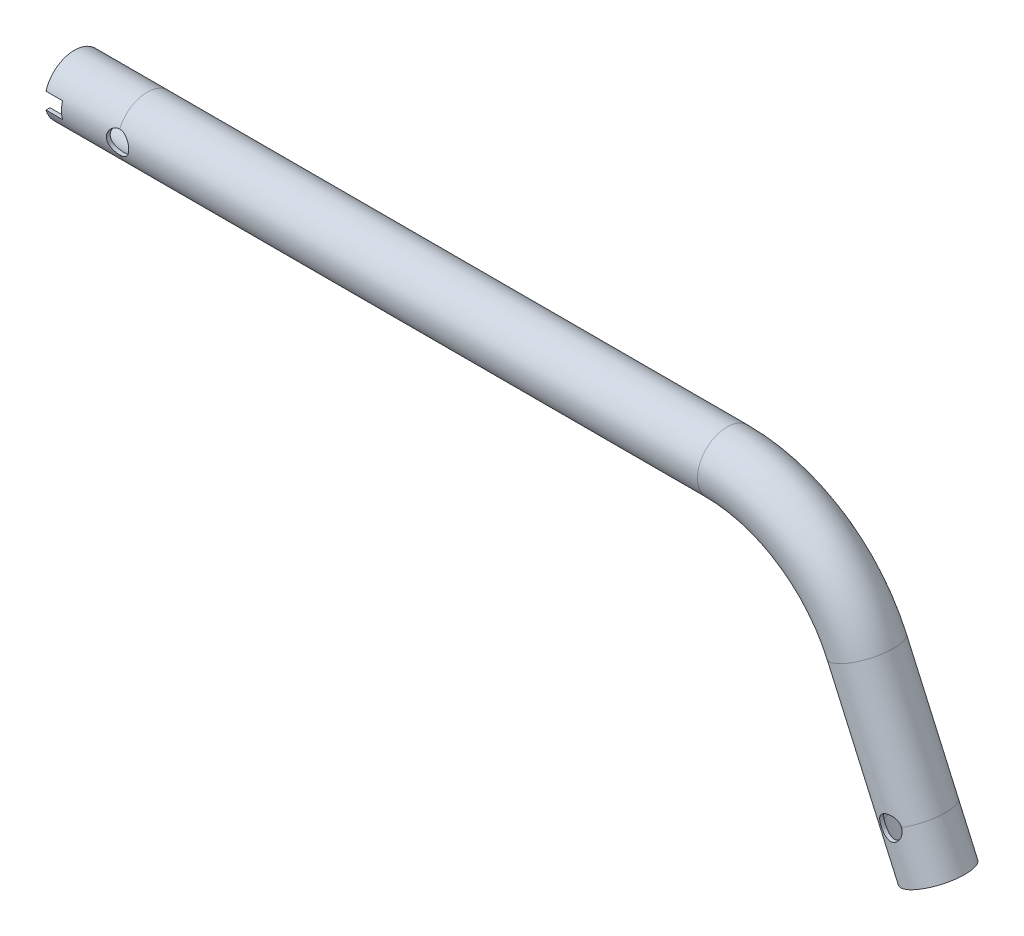
from build123d import *

# Parameters (mm, degrees)
SKETCH2_R                      = 9.25
SKETCH2_R_2                    = 8.05
CUT_EXTRUDE1_REACH             = 271.638
SKETCH3_R                      = 3.5
CUT_EXTRUDE1_DIRECTION_2_REACH = 271.638
CUT_EXTRUDE2_REACH             = 271.638
SKETCH4_R                      = 3.5
CUT_EXTRUDE3_DEPTH             = 270.638115364
CUT_EXTRUDE3_DEPTH_BACK        = 270.638115364


with BuildPart() as part:
    # Sweep1: sweep along a path in Sketch1
    with BuildLine(Plane.XY) as sweep1_path:
        Line((-22.798291955, 0), (0, 0))
        Line((0, 0), (181.888570981, 0))
        ThreePointArc((181.888570981, 0), (208.031244662, -7.743812739), (225.738752948, -28.476641132))
        Line((225.738752948, -28.476641132), (242, -65))
        Line((242, -65), (248.101049646, -78.703181865))
    # Sketch2 → Sweep1 (sweep)
    with BuildSketch(Plane.ZY.offset(22.798291955)):
        Circle(SKETCH2_R)
        Circle(SKETCH2_R_2, mode=Mode.SUBTRACT)
    sweep(path=sweep1_path.line)

    # Sketch3 → Cut-Extrude1 (cut, up to next)
    with BuildSketch(Plane.XY, mode=Mode.PRIVATE) as cut_extrude1_sk1:
        with Locations((242, -65)):
            Circle(SKETCH3_R)
    cut_extrude1_tool1 = extrude(cut_extrude1_sk1.sketch, amount=-CUT_EXTRUDE1_REACH, mode=Mode.PRIVATE) & part.part
    add(cut_extrude1_tool1.solids().sort_by_distance((242, -65, 0))[0], mode=Mode.SUBTRACT)

    # Sketch3 → Cut-Extrude1 direction 2 (cut, up to next)
    with BuildSketch(Plane.XY, mode=Mode.PRIVATE) as cut_extrude1_direction_2_sk1:
        with Locations((242, -65)):
            Circle(SKETCH3_R)
    cut_extrude1_direction_2_tool1 = extrude(cut_extrude1_direction_2_sk1.sketch, amount=CUT_EXTRUDE1_DIRECTION_2_REACH, mode=Mode.PRIVATE) & part.part
    add(cut_extrude1_direction_2_tool1.solids().sort_by_distance((242, -65, 0))[0], mode=Mode.SUBTRACT)

    # Sketch4 → Cut-Extrude2 (cut, up to next)
    with BuildSketch(Plane.XY, mode=Mode.PRIVATE) as cut_extrude2_sk1:
        Circle(SKETCH4_R)
    cut_extrude2_tool1 = extrude(cut_extrude2_sk1.sketch, amount=CUT_EXTRUDE2_REACH, mode=Mode.PRIVATE) & part.part
    add(cut_extrude2_tool1.solids().sort_by_distance((0, 0, 0))[0], mode=Mode.SUBTRACT)

    # Sketch5 → Cut-Extrude3 (cut, two sides: drawn at the far end of the back side and taken through both)
    with BuildSketch(Plane.XY.offset(-CUT_EXTRUDE3_DEPTH_BACK)):
        Polygon((-22.798291955, 0), (-22.798291955, 2.555), (-17.598291955, 2.555), (-17.598291955, -2.555), (-22.798291955, -2.555), align=None)
    extrude(amount=CUT_EXTRUDE3_DEPTH + CUT_EXTRUDE3_DEPTH_BACK, mode=Mode.SUBTRACT)


solid = part.part
